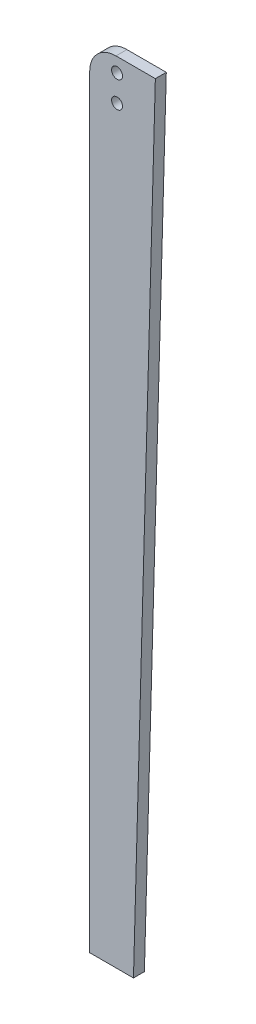
from build123d import *

# Parameters (mm, degrees)
SKETCH1_R           = 1.5875
BOSS_EXTRUDE1_DEPTH = 3.175


with BuildPart() as part:
    # Sketch1 → Boss-Extrude1 (new body)
    with BuildSketch(Plane.XY):
        with BuildLine():
            Line((-0.3175, 4.1275), (11.1125, 4.1275))
            Line((11.1125, 4.1275), (4.7625, -225.1075))
            Line((4.7625, -225.1075), (-7.9375, -225.1075))
            Line((-7.9375, -225.1075), (-7.9375, -3.4925))
            ThreePointArc((-7.9375, -3.4925), (-5.705653673, 1.895653673), (-0.3175, 4.1275))
        make_face()
        Circle(SKETCH1_R, mode=Mode.SUBTRACT)
        with Locations((0, -7.62)):
            Circle(SKETCH1_R, mode=Mode.SUBTRACT)
    extrude(amount=BOSS_EXTRUDE1_DEPTH)


solid = part.part
